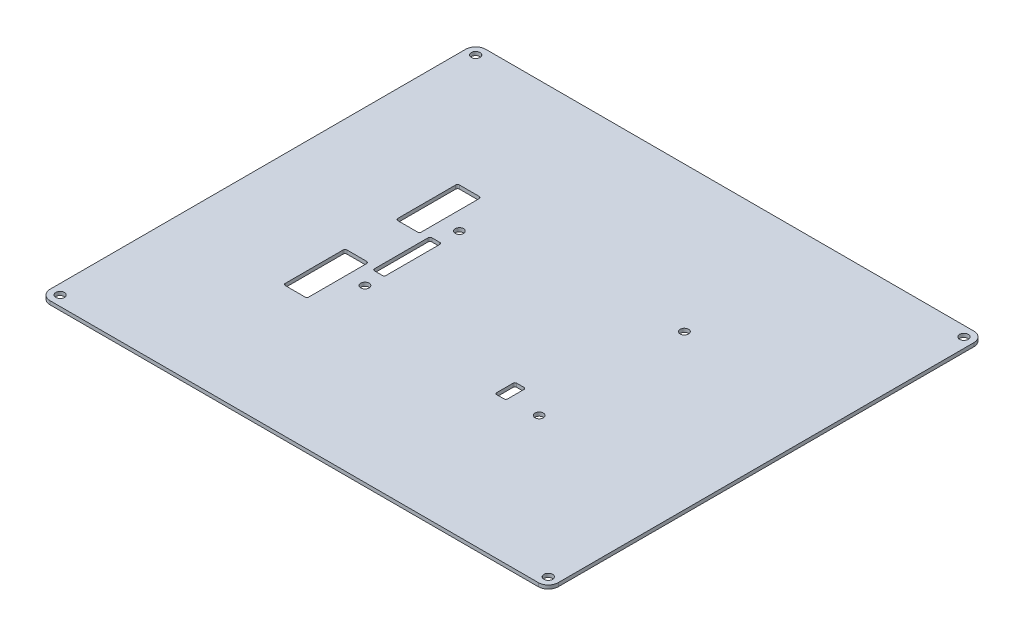
from build123d import *

# Parameters (mm, degrees)
SKETCH1_W           = 140
SKETCH1_H           = 120
SKETCH1_R           = 1.2
SKETCH1_R_2         = 1.15
BOSS_EXTRUDE1_DEPTH = 1
FILLET1_R           = 2.75
SKETCH2_W           = 6.5
SKETCH2_H           = 17
SKETCH2_W_2         = 3.2
SKETCH2_H_2         = 15.8
SKETCH2_W_3         = 3
SKETCH2_H_3         = 5.5
CUT_EXTRUDE1_DEPTH  = 10
FILLET2_R           = 0.5


with BuildPart() as part:
    # Sketch1 → Boss-Extrude1 (new body)
    with BuildSketch(Plane(origin=(0, 0, 0), x_dir=(1, 0, 0), z_dir=(0, 1, 0))):
        with Locations((70, -60)):
            Rectangle(SKETCH1_W, SKETCH1_H)
        with Locations((2.75, -2.75)):
            Circle(SKETCH1_R, mode=Mode.SUBTRACT)
        with Locations((137.25, -2.75)):
            Circle(SKETCH1_R, mode=Mode.SUBTRACT)
        with Locations((137.25, -117.25)):
            Circle(SKETCH1_R, mode=Mode.SUBTRACT)
        with Locations((2.75, -117.25)):
            Circle(SKETCH1_R, mode=Mode.SUBTRACT)
        with Locations((42.5, -47)):
            Circle(SKETCH1_R_2, mode=Mode.SUBTRACT)
        with Locations((97.5, -40)):
            Circle(SKETCH1_R_2, mode=Mode.SUBTRACT)
        with Locations((42.5, -73)):
            Circle(SKETCH1_R_2, mode=Mode.SUBTRACT)
        with Locations((97.5, -80)):
            Circle(SKETCH1_R_2, mode=Mode.SUBTRACT)
    extrude(amount=BOSS_EXTRUDE1_DEPTH)

    # Fillet1
    fillet1_edges = [part.edges().sort_by_distance(p)[0] for p in [
        (0, 0.5, 0),
        (140, 0.5, 0),
        (140, 0.5, 120),
        (0, 0.5, 120),
    ]]
    fillet(fillet1_edges, radius=FILLET1_R)

    # Sketch2 → Cut-Extrude1 (cut)
    with BuildSketch(Plane.XZ):
        with Locations((34.25, 44.5)):
            Rectangle(SKETCH2_W, SKETCH2_H)
        with Locations((34.25, 75.5)):
            Rectangle(SKETCH2_W, SKETCH2_H)
        with Locations((41.4, 60.3)):
            Rectangle(SKETCH2_W_2, SKETCH2_H_2)
        with Locations((87.7, 78.15)):
            Rectangle(SKETCH2_W_3, SKETCH2_H_3)
    extrude(amount=-CUT_EXTRUDE1_DEPTH, mode=Mode.SUBTRACT)

    # Fillet2
    fillet2_edges = [part.edges().sort_by_distance(p)[0] for p in [
        (86.2, 0.5, 75.4),
        (89.2, 0.5, 75.4),
        (86.2, 0.5, 80.9),
        (89.2, 0.5, 80.9),
        (31, 0.5, 84),
        (37.5, 0.5, 84),
        (31, 0.5, 67),
        (37.5, 0.5, 67),
        (43, 0.5, 52.4),
        (39.8, 0.5, 68.2),
        (39.8, 0.5, 52.4),
        (43, 0.5, 68.2),
        (37.5, 0.5, 53),
        (37.5, 0.5, 36),
        (31, 0.5, 53),
        (31, 0.5, 36),
    ]]
    fillet(fillet2_edges, radius=FILLET2_R)


solid = part.part
